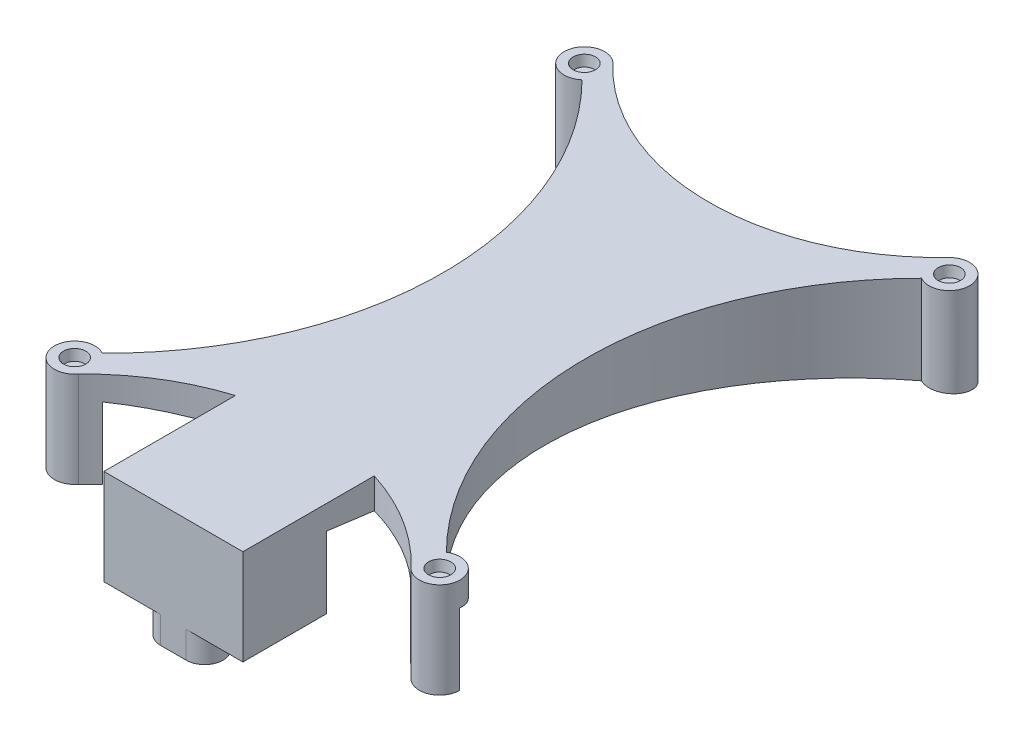
from build123d import *

# Parameters (mm, degrees)
BOSS_EXTRUDE1_DEPTH          = 16.5
CUT_EXTRUDE1_DEPTH           = 120.241920769
SKETCH4_R                    = 1.935
CUT_EXTRUDE2_DEPTH           = 1.7526
CUT_EXTRUDE2_DRAFT           = -8
CUT_EXTRUDE2_PROFILE_2_DEPTH = 1.7526
CUT_EXTRUDE2_PROFILE_2_DRAFT = -8
CUT_EXTRUDE2_PROFILE_3_DEPTH = 1.7526
CUT_EXTRUDE2_PROFILE_3_DRAFT = -8
CUT_EXTRUDE2_PROFILE_4_DEPTH = 1.7526
CUT_EXTRUDE2_PROFILE_4_DRAFT = -8
BOSS_EXTRUDE2_DEPTH          = 4.6228
FILLET1_R                    = 3.175


with BuildPart() as part:
    # Sketch1 → Boss-Extrude1 (new body)
    with BuildSketch(Plane(origin=(0, 0, 0), x_dir=(1, 0, 0), z_dir=(0, 1, 0))):
        with BuildLine():
            Line((-16.489092425, 8.308262668), (-16.489092425, -14.400532987))
            Line((-16.489092425, -14.400532987), (7.510907575, -14.400532987))
            Line((7.510907575, -14.400532987), (7.510907575, 8.280530848))
            ThreePointArc((7.510907575, 8.280530848), (16.530896146, 4.141335256), (24.254217726, -2.091115126))
            ThreePointArc((24.254217726, -2.091115126), (30.431567177, -0.503711368), (25.160101036, 3.086712235))
            ThreePointArc((25.160101036, 3.086712235), (8.212276002, 44.094775181), (25.210823781, 85.081838668))
            ThreePointArc((25.210823781, 85.081838668), (30.452099228, 88.57045388), (24.470276887, 90.534940044))
            ThreePointArc((24.470276887, 90.534940044), (-4.416407086, 78.083791262), (-33.37391246, 90.369331524))
            ThreePointArc((-33.37391246, 90.369331524), (-39.526872241, 88.379167466), (-33.769570192, 85.434147914))
            ThreePointArc((-33.769570192, 85.434147914), (-16.915711123, 44.175989738), (-34.307468452, 3.141675334))
            ThreePointArc((-34.307468452, 3.141675334), (-39.467797643, -0.598345404), (-33.256326553, -2.024662123))
            ThreePointArc((-33.256326553, -2.024662123), (-25.518622517, 4.18992316), (-16.489092425, 8.308262668))
        make_face()
    extrude(amount=BOSS_EXTRUDE1_DEPTH)

    # Sketch2 → Cut-Extrude1 (cut, through all)
    with BuildSketch(Plane(origin=(35, 0, 0), x_dir=(0, 0, -1), z_dir=(1, 0, 0))):
        Polygon((0, 12.361131379), (0, 0), (93.892114512, 0), align=None)
    extrude(amount=-CUT_EXTRUDE1_DEPTH, mode=Mode.SUBTRACT)


with BuildPart() as cut_extrude2_tool:
    # Sketch4 → Cut-Extrude2 (with draft: the straight prism first)
    with BuildSketch(Plane(origin=(0, 16.5, 0), x_dir=(1, 0, 0), z_dir=(0, 1, 0))):
        with Locations((26.983933809, 88.099467013)):
            Circle(SKETCH4_R)
    extrude(amount=-CUT_EXTRUDE2_DEPTH)
    # Cut-Extrude2: the draft: its side faces are tilted about the plane it starts from
    cut_extrude2_sides = [cut_extrude2_tool.faces().sort_by_distance(p)[0] for p in [
        (25.048933809, 15.6237, -88.099467013),
    ]]
    draft(cut_extrude2_sides, Plane(origin=(0, 16.5, 0), x_dir=(1, 0, 0), z_dir=(0, 1, 0)), CUT_EXTRUDE2_DRAFT)


with BuildPart() as part_1:
    add(part.part)

    # Cut-Extrude2: cut by cut_extrude2_tool
    add(cut_extrude2_tool.part, mode=Mode.SUBTRACT)


with BuildPart() as cut_extrude2_profile_2_tool:
    # Sketch4 → Cut-Extrude2 profile 2 (with draft: the straight prism first)
    with BuildSketch(Plane(origin=(0, 16.5, 0), x_dir=(1, 0, 0), z_dir=(0, 1, 0))):
        with Locations((-36.038066191, 88.099467013)):
            Circle(SKETCH4_R)
    extrude(amount=-CUT_EXTRUDE2_PROFILE_2_DEPTH)
    # Cut-Extrude2 profile 2: the draft: its side faces are tilted about the plane it starts from
    cut_extrude2_profile_2_sides = [cut_extrude2_profile_2_tool.faces().sort_by_distance(p)[0] for p in [
        (-37.973066191, 15.6237, -88.099467013),
    ]]
    draft(cut_extrude2_profile_2_sides, Plane(origin=(0, 16.5, 0), x_dir=(1, 0, 0), z_dir=(0, 1, 0)), CUT_EXTRUDE2_PROFILE_2_DRAFT)


with BuildPart() as part_2:
    add(part_1.part)

    # Cut-Extrude2 profile 2: cut by cut_extrude2_profile_2_tool
    add(cut_extrude2_profile_2_tool.part, mode=Mode.SUBTRACT)


with BuildPart() as cut_extrude2_profile_3_tool:
    # Sketch4 → Cut-Extrude2 profile 3 (with draft: the straight prism first)
    with BuildSketch(Plane(origin=(0, 16.5, 0), x_dir=(1, 0, 0), z_dir=(0, 1, 0))):
        with Locations((-36.038066191, 0.099467013)):
            Circle(SKETCH4_R)
    extrude(amount=-CUT_EXTRUDE2_PROFILE_3_DEPTH)
    # Cut-Extrude2 profile 3: the draft: its side faces are tilted about the plane it starts from
    cut_extrude2_profile_3_sides = [cut_extrude2_profile_3_tool.faces().sort_by_distance(p)[0] for p in [
        (-37.973066191, 15.6237, -0.099467013),
    ]]
    draft(cut_extrude2_profile_3_sides, Plane(origin=(0, 16.5, 0), x_dir=(1, 0, 0), z_dir=(0, 1, 0)), CUT_EXTRUDE2_PROFILE_3_DRAFT)


with BuildPart() as part_3:
    add(part_2.part)

    # Cut-Extrude2 profile 3: cut by cut_extrude2_profile_3_tool
    add(cut_extrude2_profile_3_tool.part, mode=Mode.SUBTRACT)


with BuildPart() as cut_extrude2_profile_4_tool:
    # Sketch4 → Cut-Extrude2 profile 4 (with draft: the straight prism first)
    with BuildSketch(Plane(origin=(0, 16.5, 0), x_dir=(1, 0, 0), z_dir=(0, 1, 0))):
        with Locations((26.983933809, 0.099467013)):
            Circle(SKETCH4_R)
    extrude(amount=-CUT_EXTRUDE2_PROFILE_4_DEPTH)
    # Cut-Extrude2 profile 4: the draft: its side faces are tilted about the plane it starts from
    cut_extrude2_profile_4_sides = [cut_extrude2_profile_4_tool.faces().sort_by_distance(p)[0] for p in [
        (25.048933809, 15.6237, -0.099467013),
    ]]
    draft(cut_extrude2_profile_4_sides, Plane(origin=(0, 16.5, 0), x_dir=(1, 0, 0), z_dir=(0, 1, 0)), CUT_EXTRUDE2_PROFILE_4_DRAFT)


with BuildPart() as part_4:
    add(part_3.part)

    # Cut-Extrude2 profile 4: cut by cut_extrude2_profile_4_tool
    add(cut_extrude2_profile_4_tool.part, mode=Mode.SUBTRACT)

    # Sketch9 → Boss-Extrude2 (add)
    with BuildSketch(Plane.XZ):
        Polygon((2.980907575, 14.400532987), (-11.959092425, 14.400532987), (-4.489092425, 0.176532987), align=None)
    extrude(amount=BOSS_EXTRUDE2_DEPTH)

    # Fillet1
    fillet1_edges = [part_4.edges().sort_by_distance(p)[0] for p in [
        (-11.959092425, -2.3114, 14.400532987),
        (2.980907575, -2.3114, 14.400532987),
        (-4.489092425, -2.3114, 0.176532987),
    ]]
    fillet(fillet1_edges, radius=FILLET1_R)


solid = part_4.part
